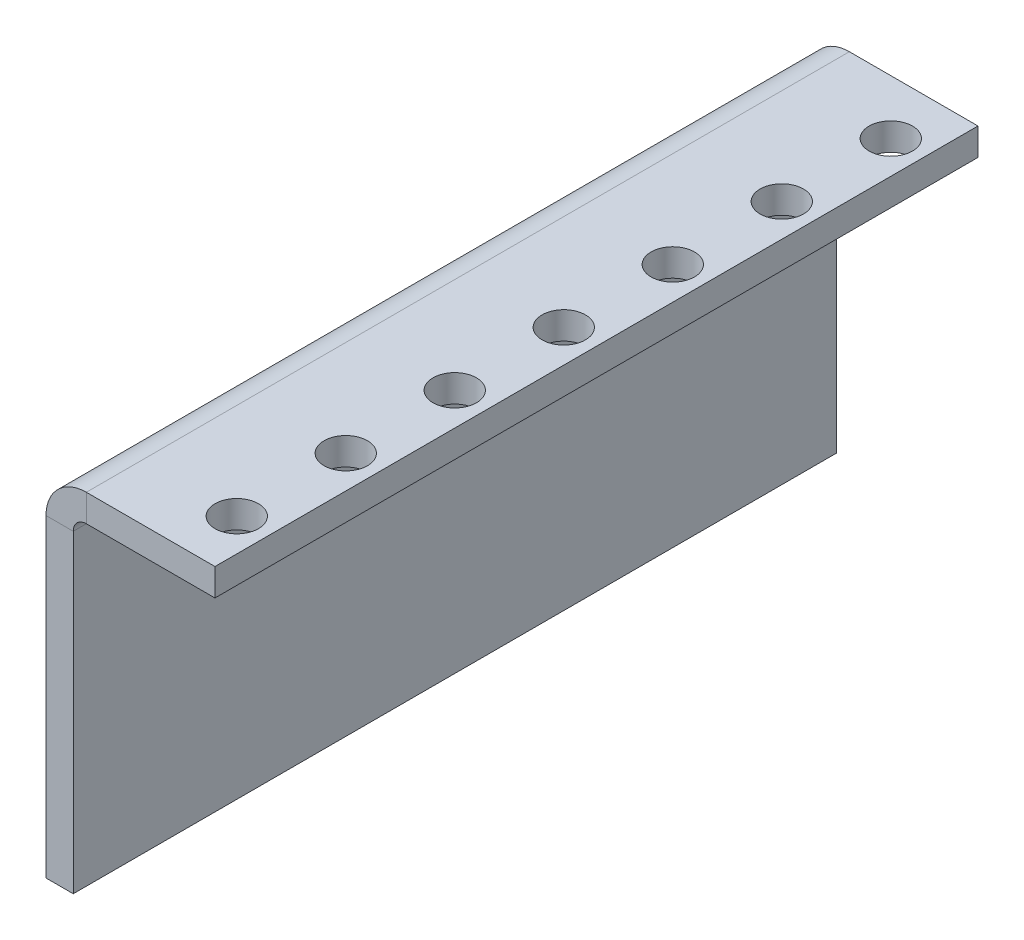
from build123d import *

# Parameters (mm, degrees)
BASE_FLANGE1_DEPTH         = 88.9
F_8_0_199_DIAMETER_HOLE1_D = 5.0546


# Sheet-metal steps are written as plain solids
with BuildPart() as part:
    # Sketch1 → Base-Flange1 (new body)
    with BuildSketch(Plane.XY):
        with BuildLine():
            Line((0, 0), (0, 36.576))
            ThreePointArc((0, 36.576), (0.446369265, 37.653630735), (1.524, 38.1))
            Line((1.524, 38.1), (16.51, 38.1))
            Line((16.51, 38.1), (16.51, 41.275))
            Line((16.51, 41.275), (1.524, 41.275))
            ThreePointArc((1.524, 41.275), (-1.798694765, 39.898694765), (-3.175, 36.576))
            Line((-3.175, 36.576), (-3.175, 0))
            Line((-3.175, 0), (0, 0))
        make_face()
    extrude(amount=BASE_FLANGE1_DEPTH)

    # #8 (0.199) Diameter Hole1 (through all)
    with Locations(Plane(origin=(12.7, 41.275, 6.35), x_dir=(0, 0, 1), z_dir=(0, 1, 0))):
        with Locations((0, 0), (12.7, 0), (25.4, 0), (38.1, 0), (50.8, 0), (63.5, 0), (76.2, 0)):
            Hole(F_8_0_199_DIAMETER_HOLE1_D / 2)


solid = part.part
